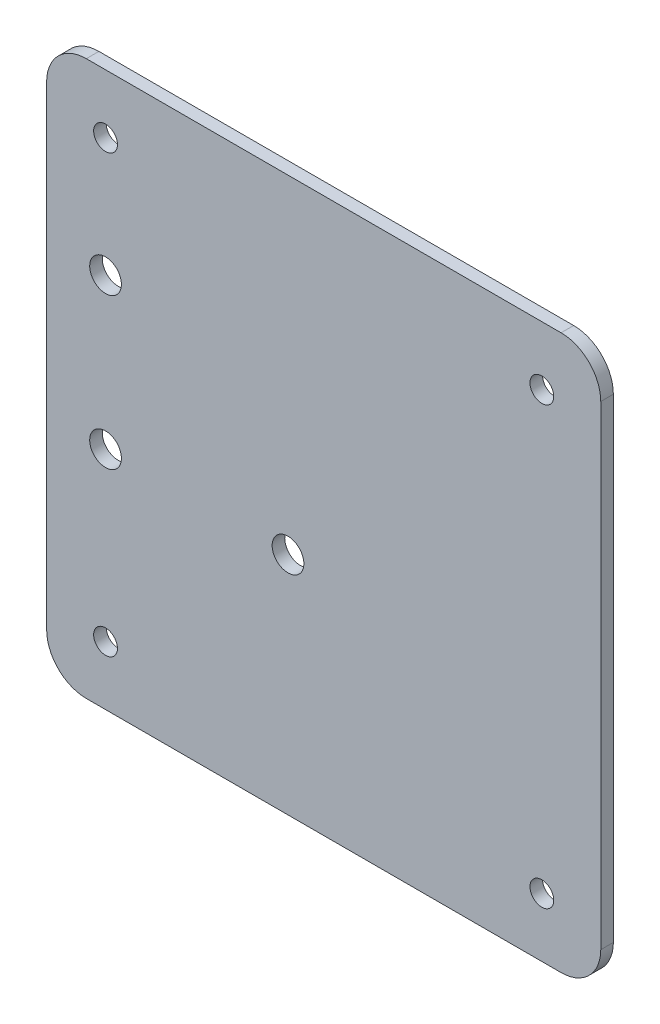
from build123d import *

# Parameters (mm, degrees)
BOSS_EXTRUDE1_DEPTH = 3.175
SKETCH2_R           = 4
SKETCH2_R_2         = 3
CUT_EXTRUDE1_DEPTH  = 1743.737838644


with BuildPart() as part:
    # Sketch1 → Boss-Extrude1 (new body)
    with BuildSketch(Plane.XY):
        with BuildLine():
            Line((65.929586762, 1731.72), (185.629586762, 1731.72))
            ThreePointArc((185.629586762, 1731.72), (192.700654574, 1728.791067812), (195.629586762, 1721.72))
            Line((195.629586762, 1721.72), (195.629586762, 1602.02))
            ThreePointArc((195.629586762, 1602.02), (192.700654574, 1594.948932188), (185.629586762, 1592.02))
            Line((185.629586762, 1592.02), (65.929586762, 1592.02))
            ThreePointArc((65.929586762, 1592.02), (58.85851895, 1594.948932188), (55.929586762, 1602.02))
            Line((55.929586762, 1602.02), (55.929586762, 1721.72))
            ThreePointArc((55.929586762, 1721.72), (58.85851895, 1728.791067812), (65.929586762, 1731.72))
        make_face()
    extrude(amount=BOSS_EXTRUDE1_DEPTH)

    # Sketch2 → Cut-Extrude1 (cut, through all)
    with BuildSketch(Plane(origin=(0, 0, 0), x_dir=(-1, 0, 0), z_dir=(0, 0, -1))):
        with Locations((-70.779586762, 1648.87)):
            Circle(SKETCH2_R)
        with Locations((-70.779586762, 1686.87)):
            Circle(SKETCH2_R)
        with Locations((-116.779586762, 1648.87)):
            Circle(SKETCH2_R)
        with Locations((-180.779586762, 1716.87)):
            Circle(SKETCH2_R_2)
        with Locations((-70.779586762, 1716.87)):
            Circle(SKETCH2_R_2)
        with Locations((-180.779586762, 1606.87)):
            Circle(SKETCH2_R_2)
        with Locations((-70.779586762, 1606.87)):
            Circle(SKETCH2_R_2)
    extrude(amount=-CUT_EXTRUDE1_DEPTH, mode=Mode.SUBTRACT)


solid = part.part
